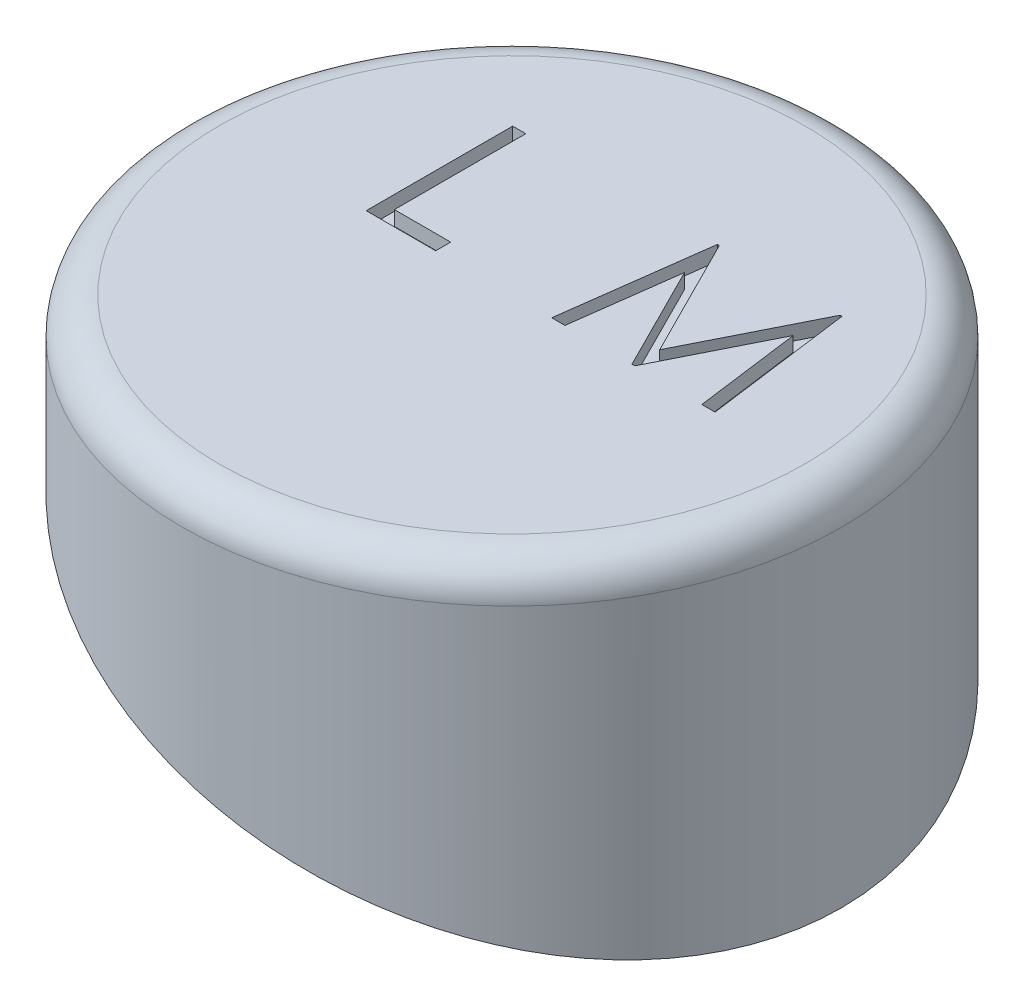
from build123d import *

# Parameters (mm, degrees)
SKETCH1_R                      = 45
BOSS_EXTRUDE1_DEPTH            = 50
CUT_EXTRUDE1_REACH             = 82.932
CUT_EXTRUDE1_DIRECTION_2_REACH = 82.932
FILLET1_R                      = 5
CUT_EXTRUDE2_DEPTH             = 2
SHELL1_START                   = 1.721637966
SHELL1_OUTLINE_R               = 40
SHELL1_DEPTH                   = 41.278362034
SHELL1_START_2                 = 43
SHELL1_2_OUTLINE_R             = 40
SHELL1_2_DEPTH                 = 2


with BuildPart() as part:
    # Sketch1 → Boss-Extrude1 (new body)
    with BuildSketch(Plane(origin=(0, 0, 0), x_dir=(1, 0, 0), z_dir=(0, 1, 0))):
        with Locations(Location((0, 0, 0), (0, 0, 270))):
            Circle(SKETCH1_R)
    extrude(amount=BOSS_EXTRUDE1_DEPTH)

    # Sketch2 → Cut-Extrude1 (cut, up to next)
    with BuildSketch(Plane.XY, mode=Mode.PRIVATE) as cut_extrude1_sk1:
        Polygon((45, 0), (-45, 0), (-45, 30.989485196), align=None)
    cut_extrude1_tool1 = extrude(cut_extrude1_sk1.sketch, amount=-CUT_EXTRUDE1_REACH, mode=Mode.PRIVATE) & part.part
    add(cut_extrude1_tool1.solids().sort_by_distance((-15, 10.329828, 0))[0], mode=Mode.SUBTRACT)

    # Sketch2 → Cut-Extrude1 direction 2 (cut, up to next)
    with BuildSketch(Plane.XY, mode=Mode.PRIVATE) as cut_extrude1_direction_2_sk1:
        Polygon((45, 0), (-45, 0), (-45, 30.989485196), align=None)
    cut_extrude1_direction_2_tool1 = extrude(cut_extrude1_direction_2_sk1.sketch, amount=CUT_EXTRUDE1_DIRECTION_2_REACH, mode=Mode.PRIVATE) & part.part
    add(cut_extrude1_direction_2_tool1.solids().sort_by_distance((-15, 10.329828, 0))[0], mode=Mode.SUBTRACT)

    # Fillet1
    fillet1_edges = [part.edges().sort_by_distance(p)[0] for p in [
        (0, 50, -45),
    ]]
    fillet(fillet1_edges, radius=FILLET1_R)

    # Sketch4 → Cut-Extrude2 (cut)
    with BuildSketch(Plane(origin=(0, 50, 0), x_dir=(1, 0, 0), z_dir=(0, 1, 0))):
        Polygon((-19.909733282, 20), (-18.114861487, 20), (-18.114861487, 2.051282051), (-10.422553795, 2.051282051), (-10.422553795, 0), (-19.909733282, 0), align=None)
        Polygon((5.423600051, 0), (8.06382441, 20), (8.320234666, 20), (16.577446205, 3.58974359), (24.814625692, 20), (25.075042359, 20), (27.731292359, 0), (25.928407743, 0), (24.013343641, 14.391025641), (16.793792359, 0), (16.389144923, 0), (9.141548769, 14.423076923), (7.230491077, 0), align=None)
    extrude(amount=-CUT_EXTRUDE2_DEPTH, mode=Mode.SUBTRACT)

    # Shell1: read off the stored shape, not the designer's step
    # Shell1 outline → Shell1 (cut)
    with BuildSketch(Plane(origin=(0, 0, 0), x_dir=(1, 0, 0), z_dir=(0, 1, 0)).offset(SHELL1_START)):
        Circle(SHELL1_OUTLINE_R)
    extrude(amount=SHELL1_DEPTH, mode=Mode.SUBTRACT)

    # Shell1 2 outline → Shell1 2 (cut)
    with BuildSketch(Plane(origin=(0, 0, 0), x_dir=(1, 0, 0), z_dir=(0, 1, 0)).offset(SHELL1_START_2)):
        Circle(SHELL1_2_OUTLINE_R)
        Polygon((-5.422553795, 7.051282051), (-5.422553795, -5), (-24.909733282, -5), (-24.909733282, 25), (-13.114861487, 25), (-13.114861487, 7.051282051), align=None, mode=Mode.SUBTRACT)
        Polygon((11.965201342, -2.331995426), (11.611690736, -5), (-0.279835267, -5), (3.680501271, 25), (11.401650362, 25), (16.572020474, 14.72448521), (21.729847234, 25), (29.454884993, 25), (33.439259993, -5), (21.549698117, -5), (21.1995112, -2.368469859), (19.879350477, -5), (13.30587364, -5), align=None, mode=Mode.SUBTRACT)
    extrude(amount=SHELL1_2_DEPTH, mode=Mode.SUBTRACT)


solid = part.part
